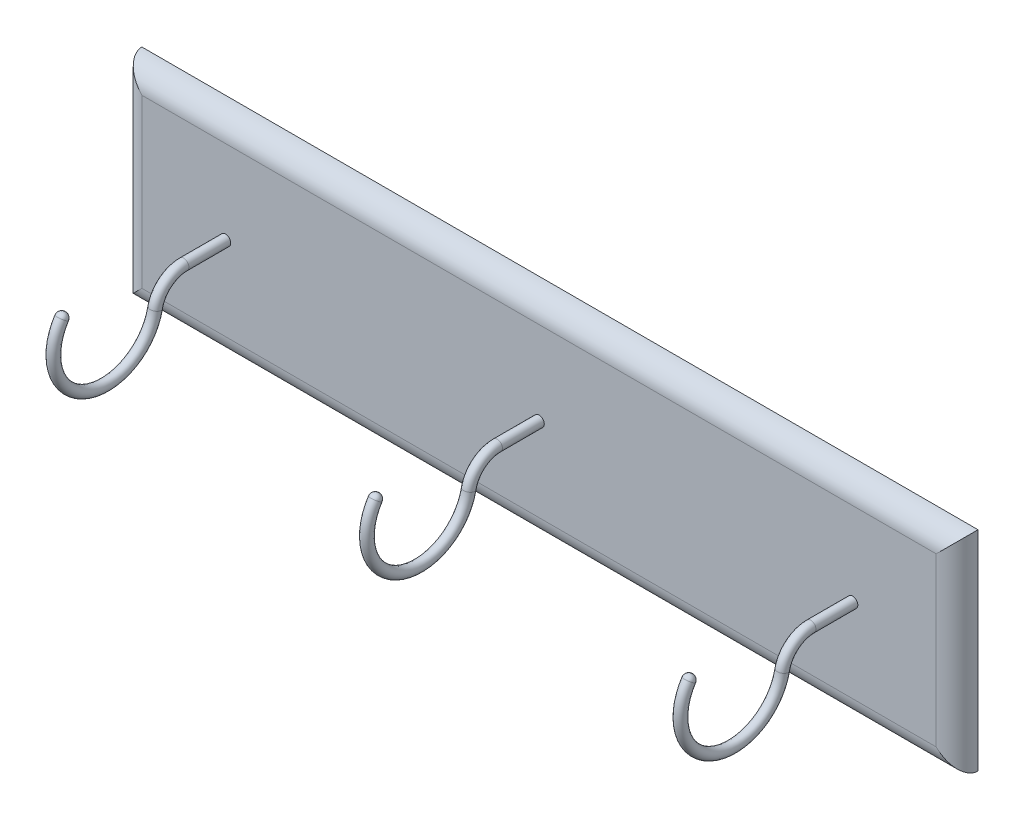
from build123d import *

# Parameters (mm, degrees)
CROQUIS1_W                  = 400
CROQUIS1_H                  = 100
SALIENTE_EXTRUIR1_DEPTH     = 10
REDONDEO1_R                 = 10
CROQUIS2_R                  = 2.5
C_PULA1_FACE_RADIUS         = 2.5
C_PULA1_HEIGHT              = 2.5
MATRIZL3_COUNT              = 2
MATRIZL3_PITCH              = 150
MATRIZL3_COPY_1_FACE_RADIUS = 2.5
MATRIZL3_COPY_1_HEIGHT      = 2.5
MATRIZL4_COUNT              = 2
MATRIZL4_PITCH              = 150
MATRIZL4_COPY_1_FACE_RADIUS = 2.5
MATRIZL4_COPY_1_HEIGHT      = 2.5


with BuildPart() as part:
    # Croquis1 → Saliente-Extruir1 (new body)
    with BuildSketch(Plane.XY):
        Rectangle(CROQUIS1_W, CROQUIS1_H)
    extrude(amount=SALIENTE_EXTRUIR1_DEPTH)

    # Redondeo1
    redondeo1_edges = [part.edges().sort_by_distance(p)[0] for p in [
        (0, -50, 10),
        (-200, 0, 10),
        (0, 50, 10),
        (200, 0, 10),
    ]]
    fillet(redondeo1_edges, radius=REDONDEO1_R - 0.0001)  # a hair under: the kernel refuses the full size

    # Barrer1: sweep along a path in Croquis3
    with BuildLine(Plane(origin=(0, 0, 0), x_dir=(0, 0, -1), z_dir=(1, 0, 0))) as barrer1_path:
        Line((-10, 0), (-30, 0))
        ThreePointArc((-30, 0), (-38.844802549, -3.167805556), (-43.667308782, -11.230618826))
        ThreePointArc((-43.667308782, -11.230618826), (-77.036807223, -29.232406086), (-88.371733594, 6.949180598))
    # Croquis2 → Barrer1 (sweep)
    with BuildSketch(Plane.XY.offset(10)):
        Circle(CROQUIS2_R)
    barrer1 = sweep(path=barrer1_path.line)

    # Cúpula1: a dome of height H over a round flat face of radius A is a cap of a sphere of radius (A * A + H * H) / (2 * H)
    c_pula1_r = (C_PULA1_FACE_RADIUS * C_PULA1_FACE_RADIUS + C_PULA1_HEIGHT * C_PULA1_HEIGHT) / (2 * C_PULA1_HEIGHT)
    c_pula1_base = Plane((0, 6.949180598, 88.371733594), z_dir=(0, 0.83790241978, -0.545820057277))
    with Locations(c_pula1_base.offset(C_PULA1_HEIGHT - c_pula1_r)):
        c_pula1_ball = Sphere(c_pula1_r, mode=Mode.PRIVATE)
    add(split(c_pula1_ball, bisect_by=c_pula1_base, keep=Keep.TOP, mode=Mode.PRIVATE))

    # MatrizL3: Barrer1 ×2
    with Locations(*[(i * MATRIZL3_PITCH, 0, 0) for i in range(1, MATRIZL3_COUNT)]):
        add(barrer1)

    # MatrizL3 copy 1: a dome of height H over a round flat face of radius A is a cap of a sphere of radius (A * A + H * H) / (2 * H)
    matrizl3_copy_1_r = (MATRIZL3_COPY_1_FACE_RADIUS * MATRIZL3_COPY_1_FACE_RADIUS + MATRIZL3_COPY_1_HEIGHT * MATRIZL3_COPY_1_HEIGHT) / (2 * MATRIZL3_COPY_1_HEIGHT)
    matrizl3_copy_1_base = Plane((150, 6.949180598, 88.371733594), z_dir=(0, 0.83790241978, -0.545820057277))
    with Locations(matrizl3_copy_1_base.offset(MATRIZL3_COPY_1_HEIGHT - matrizl3_copy_1_r)):
        matrizl3_copy_1_ball = Sphere(matrizl3_copy_1_r, mode=Mode.PRIVATE)
    add(split(matrizl3_copy_1_ball, bisect_by=matrizl3_copy_1_base, keep=Keep.TOP, mode=Mode.PRIVATE))

    # MatrizL4: Barrer1 ×2
    with Locations(*[(-i * MATRIZL4_PITCH, 0, 0) for i in range(1, MATRIZL4_COUNT)]):
        add(barrer1)

    # MatrizL4 copy 1: a dome of height H over a round flat face of radius A is a cap of a sphere of radius (A * A + H * H) / (2 * H)
    matrizl4_copy_1_r = (MATRIZL4_COPY_1_FACE_RADIUS * MATRIZL4_COPY_1_FACE_RADIUS + MATRIZL4_COPY_1_HEIGHT * MATRIZL4_COPY_1_HEIGHT) / (2 * MATRIZL4_COPY_1_HEIGHT)
    matrizl4_copy_1_base = Plane((-150, 6.949180598, 88.371733594), z_dir=(0, 0.83790241978, -0.545820057277))
    with Locations(matrizl4_copy_1_base.offset(MATRIZL4_COPY_1_HEIGHT - matrizl4_copy_1_r)):
        matrizl4_copy_1_ball = Sphere(matrizl4_copy_1_r, mode=Mode.PRIVATE)
    add(split(matrizl4_copy_1_ball, bisect_by=matrizl4_copy_1_base, keep=Keep.TOP, mode=Mode.PRIVATE))


solid = part.part
